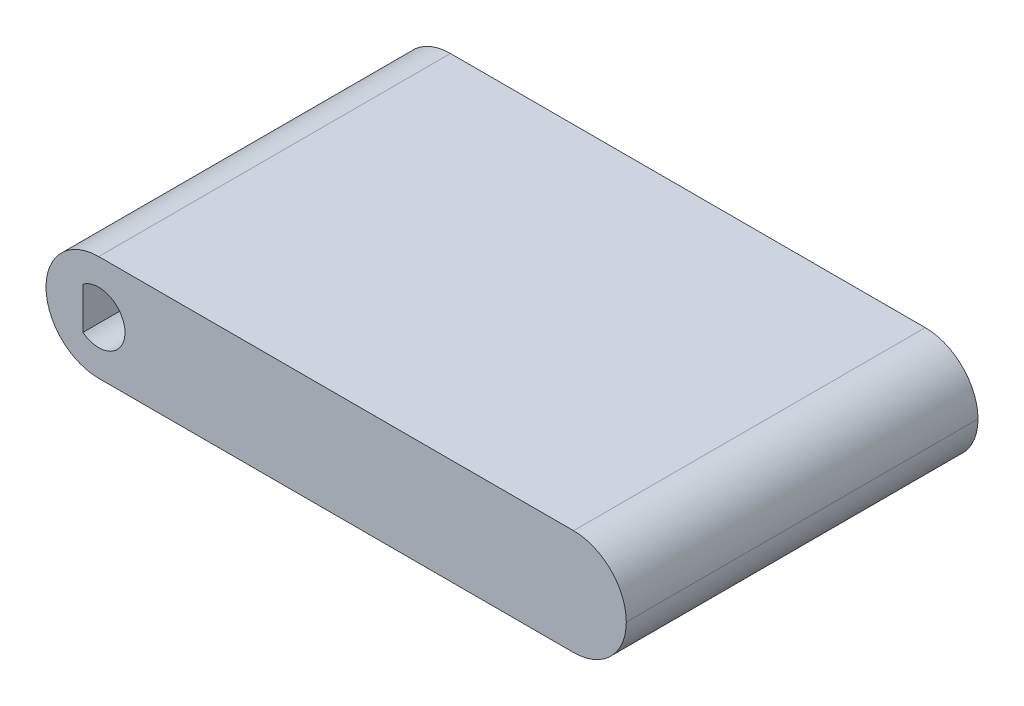
from build123d import *

# Parameters (mm, degrees)
SKETCH1_W           = 66
SKETCH1_H           = 12
SKETCH1_R           = 2.98
BOSS_EXTRUDE1_DEPTH = 20
FILLET2_R           = 6
BOSS_EXTRUDE2_DEPTH = 40


with BuildPart() as part:
    # Sketch1 → Boss-Extrude1 (new, symmetric)
    with BuildSketch(Plane.XY):
        with Locations((27, 0)):
            Rectangle(SKETCH1_W, SKETCH1_H)
        Circle(SKETCH1_R, mode=Mode.SUBTRACT)
    extrude(amount=BOSS_EXTRUDE1_DEPTH, both=True)

    # Fillet2
    fillet2_edges = [part.edges().sort_by_distance(p)[0] for p in [
        (60, -6, 0),
        (60, 6, 0),
        (-6, -6, 0),
        (-6, 6, 0),
    ]]
    fillet(fillet2_edges, radius=FILLET2_R - 0.0001)  # a hair under: the kernel refuses the full size

    # Sketch2 → Boss-Extrude2 (add)
    with BuildSketch(Plane(origin=(0, 0, -20), x_dir=(-1, 0, 0), z_dir=(0, 0, -1))):
        with BuildLine():
            Line((1.8, -2.374952631), (1.8, 2.374952631))
            ThreePointArc((1.8, 2.374952631), (2.98, 0), (1.8, -2.374952631))
        make_face()
    extrude(amount=-BOSS_EXTRUDE2_DEPTH)


solid = part.part
